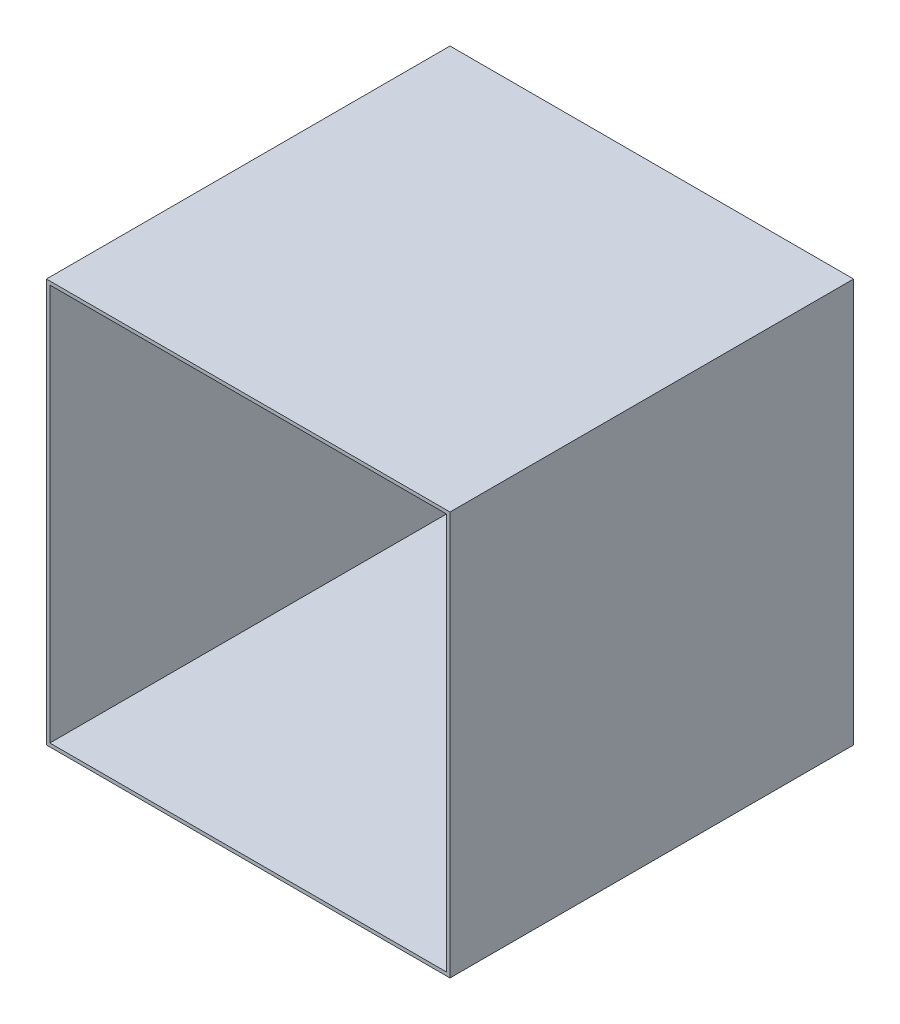
from build123d import *

# Parameters (mm, degrees)
CROQUIS1_W              = 70
CROQUIS1_H              = 70
SALIENTE_EXTRUIR1_DEPTH = 70
VACIADO1_T              = -0.6


with BuildPart() as part:
    # Croquis1 → Saliente-Extruir1 (new body)
    with BuildSketch(Plane.XY):
        with Locations((35, 35)):
            Rectangle(CROQUIS1_W, CROQUIS1_H)
    extrude(amount=SALIENTE_EXTRUIR1_DEPTH)

    # Vaciado1
    vaciado1_openings = [part.faces().sort_by_distance(p)[0] for p in [
        (35, 35, 0),
        (35, 35, 70),
    ]]
    offset(amount=VACIADO1_T, openings=vaciado1_openings, kind=Kind.INTERSECTION)


solid = part.part
